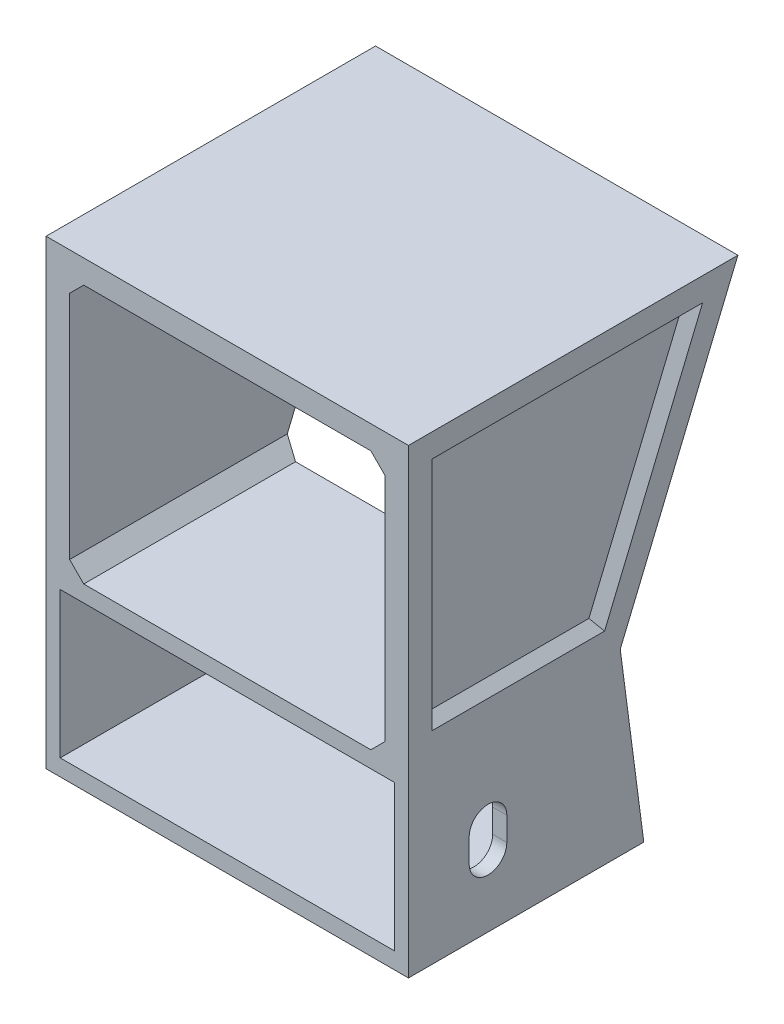
from build123d import *

# Parameters (mm, degrees)
SKIZZE1_W                                   = 77
SKIZZE1_H                                   = 38
AUFSATZ_LINEAR_AUSTRAGEN1_DEPTH             = 25
SKIZZE5_R                                   = 2.75
SCHNITT_LINEAR_AUSTRAGEN1_DEPTH             = 66.903338307
SCHNITT_LINEAR_AUSTRAGEN2_DEPTH             = 50.681485485
SCHNITT_LINEAR_AUSTRAGEN2_DEPTH_BACK        = 50.681485485
SKIZZE8_W                                   = 67
SKIZZE8_H                                   = 28.327535794
SCHNITT_LINEAR_AUSTRAGEN8_DEPTH             = 3
SCHNITT_LINEAR_AUSTRAGEN8_DRAFT             = -45
SKIZZE9_W                                   = 71
SKIZZE9_H                                   = 31
SCHNITT_LINEAR_AUSTRAGEN9_DEPTH             = 50.681485485
SCHNITT_LINEAR_AUSTRAGEN9_DIRECTION_2_REACH = 51.681
AUFSATZ_LINEAR_START                        = -16.974828462
AUFSATZ_LINEAR_AUSTRAGEN2_OUTLINE_W         = 8
AUFSATZ_LINEAR_AUSTRAGEN2_OUTLINE_H         = 31
AUFSATZ_LINEAR_AUSTRAGEN2_DEPTH             = 4.078947369
AUFSATZ_LINEAR_AUSTRAGEN4_DEPTH             = 77
SKIZZE23_W                                  = 67
SKIZZE23_H                                  = 55
SCHNITT_LINEAR_AUSTRAGEN19_DEPTH            = 113.353237604
SCHNITT_LINEAR_AUSTRAGEN20_DEPTH            = 2
SCHNITT_LINEAR_AUSTRAGEN20_DRAFT            = -45
SPIEGELN9_COPY_1_DEPTH                      = 2
SPIEGELN9_COPY_1_DRAFT                      = -45
FASE2_SIZE                                  = 3
SCHNITT_LINEAR_AUSTRAGEN21_DEPTH            = 3


# Read off the part's stored shape, not the designer's step: Aufsatz-Linear austragen2
with BuildPart() as part:
    # Skizze1 → Aufsatz-Linear austragen1 (new, symmetric)
    with BuildSketch(Plane.XY):
        Rectangle(SKIZZE1_W, SKIZZE1_H)
    extrude(amount=AUFSATZ_LINEAR_AUSTRAGEN1_DEPTH, both=True)

    # Skizze5 → Schnitt-Linear austragen1 (cut, through all)
    with BuildSketch(Plane(origin=(0, 0, -25), x_dir=(-1, 0, 0), z_dir=(0, 0, -1))):
        with Locations((-20.32, 6.35)):
            Circle(SKIZZE5_R)
        with Locations((-20.32, -6.35)):
            Circle(SKIZZE5_R)
        with Locations((-10.16, 6.35)):
            Circle(SKIZZE5_R)
        with Locations((-10.16, -6.35)):
            Circle(SKIZZE5_R)
        with Locations((0, 6.35)):
            Circle(SKIZZE5_R)
        with Locations((0, -6.35)):
            Circle(SKIZZE5_R)
        with Locations((10.16, 6.35)):
            Circle(SKIZZE5_R)
        with Locations((10.16, -6.35)):
            Circle(SKIZZE5_R)
        with Locations((20.32, 6.35)):
            Circle(SKIZZE5_R)
        with Locations((20.32, -6.35)):
            Circle(SKIZZE5_R)
    extrude(amount=-SCHNITT_LINEAR_AUSTRAGEN1_DEPTH, mode=Mode.SUBTRACT)

    # Skizze6 → Schnitt-Linear austragen2 (cut, two sides: drawn at the far end of the back side and taken through both)
    with BuildSketch(Plane(origin=(0, 0, 0), x_dir=(0, 0, -1), z_dir=(1, 0, 0)).offset(-SCHNITT_LINEAR_AUSTRAGEN2_DEPTH_BACK)):
        Polygon((20, 19), (25, 19), (25, -19), align=None)
    extrude(amount=SCHNITT_LINEAR_AUSTRAGEN2_DEPTH + SCHNITT_LINEAR_AUSTRAGEN2_DEPTH_BACK, mode=Mode.SUBTRACT)


with BuildPart() as schnitt_linear_austragen8_tool:
    # Skizze8 → Schnitt-Linear austragen8 (with draft: the straight prism first)
    with BuildSketch(Plane(origin=(0, 2.910142954, -22.117086453), x_dir=(1, 0, 0), z_dir=(0, 0.1304545125713874, -0.9914542955425438))):
        with Locations((0, 2.935226533)):
            Rectangle(SKIZZE8_W, SKIZZE8_H)
    extrude(amount=-SCHNITT_LINEAR_AUSTRAGEN8_DEPTH)
    # Schnitt-Linear austragen8: the draft: its side faces are tilted about the plane it starts from
    schnitt_linear_austragen8_sides = [schnitt_linear_austragen8_tool.faces().sort_by_distance(p)[0] for p in [
        (-33.5, -0.195681769, -21.012818557),
        (0, 13.847046753, -19.16509112),
        (33.5, -0.195681769, -21.012818557),
        (0, -14.238410291, -22.860545994),
    ]]
    draft(schnitt_linear_austragen8_sides, Plane(origin=(0, 2.910142954, -22.117086453), x_dir=(1, 0, 0), z_dir=(0, 0.1304545125713874, -0.9914542955425438)), SCHNITT_LINEAR_AUSTRAGEN8_DRAFT)


with BuildPart() as part_1:
    add(part.part)

    # Schnitt-Linear austragen8: cut by schnitt_linear_austragen8_tool
    add(schnitt_linear_austragen8_tool.part, mode=Mode.SUBTRACT)

    # Skizze9 → Schnitt-Linear austragen9 (cut)
    with BuildSketch(Plane.XY):
        Rectangle(SKIZZE9_W, SKIZZE9_H)
    extrude(amount=SCHNITT_LINEAR_AUSTRAGEN9_DEPTH, mode=Mode.SUBTRACT)

    # Schnitt-Linear austragen9 direction 2: up to this plane
    schnitt_linear_austragen9_direction_2_end = Plane(origin=(0, 1.93173411, -14.681179237), z_dir=(0, 0.13045451257138746, -0.9914542955425438))
    # Skizze9 → Schnitt-Linear austragen9 direction 2 (cut, up to the surface)
    with BuildSketch(Plane.XY, mode=Mode.PRIVATE) as schnitt_linear_austragen9_direction_2_sk1:
        Rectangle(SKIZZE9_W, SKIZZE9_H)
    schnitt_linear_austragen9_direction_2_tool1 = split(extrude(schnitt_linear_austragen9_direction_2_sk1.sketch, amount=-SCHNITT_LINEAR_AUSTRAGEN9_DIRECTION_2_REACH, mode=Mode.PRIVATE), bisect_by=schnitt_linear_austragen9_direction_2_end, keep=Keep.BOTH, mode=Mode.PRIVATE)
    add(schnitt_linear_austragen9_direction_2_tool1.solids().sort_by_distance((0, 0, 0))[0], mode=Mode.SUBTRACT)

    # Aufsatz-Linear austragen2 outline → Aufsatz-Linear austragen2 (add)
    with BuildSketch(Plane.XY.offset(AUFSATZ_LINEAR_START)):
        with Locations((-31.5, 0)):
            Rectangle(AUFSATZ_LINEAR_AUSTRAGEN2_OUTLINE_W, AUFSATZ_LINEAR_AUSTRAGEN2_OUTLINE_H)
        with Locations((31.5, 0)):
            Rectangle(AUFSATZ_LINEAR_AUSTRAGEN2_OUTLINE_W, AUFSATZ_LINEAR_AUSTRAGEN2_OUTLINE_H)
    extrude(amount=AUFSATZ_LINEAR_AUSTRAGEN2_DEPTH)

    # Skizze22 → Aufsatz-Linear austragen4 (add)
    with BuildSketch(Plane(origin=(38.5, 0, 0), x_dir=(0, 0, -1), z_dir=(1, 0, 0))):
        Polygon((20, 19), (45, 79), (-25, 79), (-25, 19), align=None)
    extrude(amount=-AUFSATZ_LINEAR_AUSTRAGEN4_DEPTH)

    # Skizze23 → Schnitt-Linear austragen19 (cut, through all)
    with BuildSketch(Plane.XY.offset(25)):
        with Locations((0, 46.5)):
            Rectangle(SKIZZE23_W, SKIZZE23_H)
    extrude(amount=-SCHNITT_LINEAR_AUSTRAGEN19_DEPTH, mode=Mode.SUBTRACT)


with BuildPart() as schnitt_linear_austragen20_tool:
    # Skizze24 → Schnitt-Linear austragen20 (with draft: the straight prism first)
    with BuildSketch(Plane(origin=(38.5, 0, 0), x_dir=(0, 0, -1), z_dir=(1, 0, 0))):
        Polygon((16.666666667, 24), (37.5, 74), (-20, 74), (-20, 24), align=None)
    extrude(amount=-SCHNITT_LINEAR_AUSTRAGEN20_DEPTH)
    # Schnitt-Linear austragen20: the draft: its side faces are tilted about the plane it starts from
    schnitt_linear_austragen20_sides = [schnitt_linear_austragen20_tool.faces().sort_by_distance(p)[0] for p in [
        (37.5, 49, -27.083333333),
        (37.5, 74, -8.75),
        (37.5, 49, 20),
        (37.5, 24, 1.666666667),
    ]]
    draft(schnitt_linear_austragen20_sides, Plane(origin=(38.5, 0, 0), x_dir=(0, 0, -1), z_dir=(1, 0, 0)), SCHNITT_LINEAR_AUSTRAGEN20_DRAFT)


with BuildPart() as part_2:
    add(part_1.part)

    # Schnitt-Linear austragen20: cut by schnitt_linear_austragen20_tool
    add(schnitt_linear_austragen20_tool.part, mode=Mode.SUBTRACT)


with BuildPart() as spiegeln9_copy_1_tool:
    # Spiegeln9 copy 1 sketch → Spiegeln9 copy 1 (with draft: the straight prism first)
    with BuildSketch(Plane(origin=(-38.5, 0, 0), x_dir=(0, 0, -1), z_dir=(-1, 0, 0))):
        Polygon((16.666666667, -24), (37.5, -74), (-20, -74), (-20, -24), align=None)
    extrude(amount=-SPIEGELN9_COPY_1_DEPTH)
    # Spiegeln9 copy 1: the draft: its side faces are tilted about the plane it starts from
    spiegeln9_copy_1_sides = [spiegeln9_copy_1_tool.faces().sort_by_distance(p)[0] for p in [
        (-37.5, 49, -27.083333333),
        (-37.5, 74, -8.75),
        (-37.5, 49, 20),
        (-37.5, 24, 1.666666667),
    ]]
    draft(spiegeln9_copy_1_sides, Plane(origin=(-38.5, 0, 0), x_dir=(0, 0, -1), z_dir=(-1, 0, 0)), SPIEGELN9_COPY_1_DRAFT)


with BuildPart() as part_3:
    add(part_2.part)

    # Spiegeln9 copy 1: cut by spiegeln9_copy_1_tool
    add(spiegeln9_copy_1_tool.part, mode=Mode.SUBTRACT)

    # Fase2
    fase2_edges = [part_3.edges().sort_by_distance(p)[0] for p in [
        (33.5, 74, -8.958333333),
        (33.5, 19, 2.5),
        (-33.5, 19, 2.5),
        (-33.5, 74, -8.958333333),
    ]]
    chamfer(fase2_edges, length=FASE2_SIZE)

    # Skizze25 → Schnitt-Linear austragen21 (cut)
    with BuildSketch(Plane.ZY.offset(-35.5)):
        with BuildLine():
            Line((4.104118907, -4.5), (4.104118907, 0.5))
            ThreePointArc((4.104118907, 0.5), (8.104118907, 4.5), (12.104118907, 0.5))
            Line((12.104118907, 0.5), (12.104118907, -4.5))
            ThreePointArc((12.104118907, -4.5), (8.104118907, -8.5), (4.104118907, -4.5))
        make_face()
    extrude(amount=-SCHNITT_LINEAR_AUSTRAGEN21_DEPTH, mode=Mode.SUBTRACT)


solid = part_3.part
